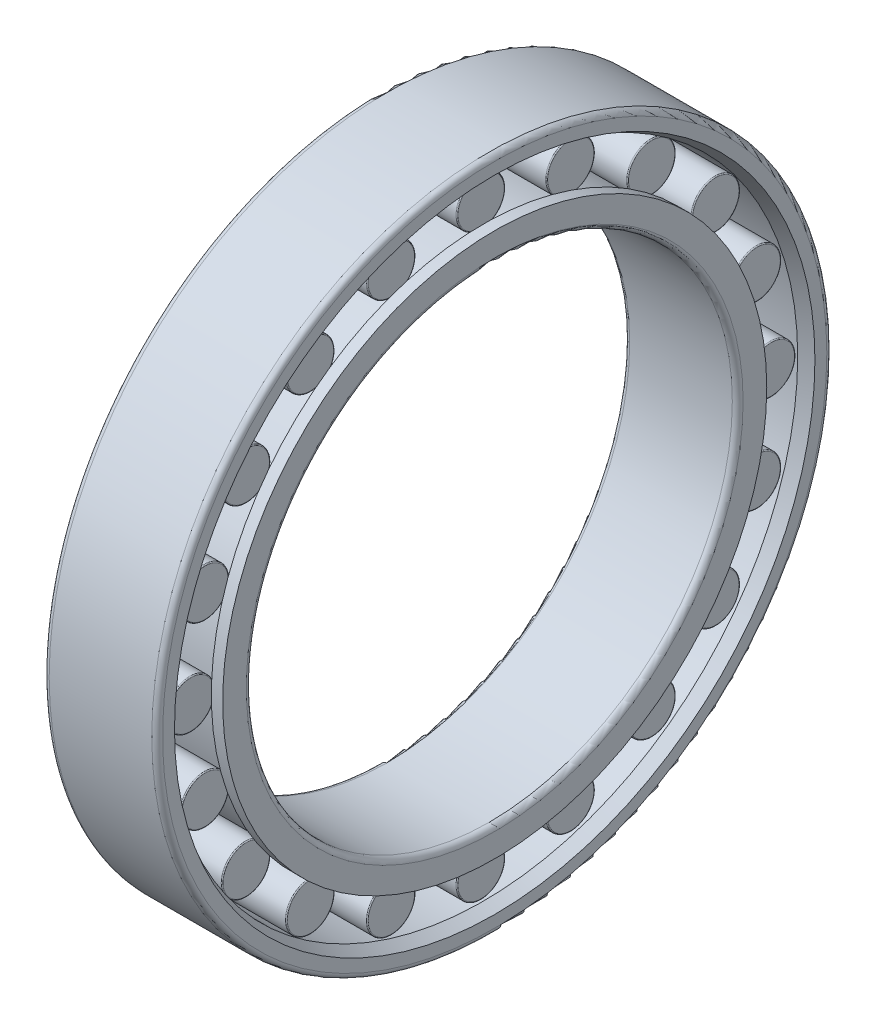
from build123d import *

# Parameters (mm, degrees)
ROLLERSDETAILED_COUNT = 20
ROLLERSDETAILED_ANGLE = 342


with BuildPart() as part:
    # OutRacSke → OuterRace (revolve)
    with BuildSketch(Plane.XY):
        with BuildLine():
            Line((16.8, 116.42), (21, 118.594375))
            Line((21, 118.594375), (21, 123))
            ThreePointArc((21, 123), (20.414213562, 124.414213562), (19, 125))
            Line((19, 125), (-19, 125))
            ThreePointArc((-19, 125), (-20.414213562, 124.414213562), (-21, 123))
            Line((-21, 123), (-21, 118.594375))
            Line((-21, 118.594375), (-16.8, 116.42))
            Line((-16.8, 116.42), (16.8, 116.42))
        make_face()
    revolve(axis=Axis((-90, 0, 0), (1, 0, 0)))

    # RolDetSke → RollerDetailed (revolve)
    with BuildSketch(Plane.XY):
        with BuildLine():
            Line((-15.96, 116.068), (-15.96, 107.5))
            Line((-15.96, 107.5), (15.96, 107.5))
            Line((15.96, 107.5), (15.96, 116.068))
            ThreePointArc((15.96, 116.068), (15.855437121, 116.320437121), (15.603, 116.425))
            Line((15.603, 116.425), (-15.603, 116.425))
            ThreePointArc((-15.603, 116.425), (-15.855437121, 116.320437121), (-15.96, 116.068))
        make_face()
    rollerdetailed = revolve(axis=Axis((-33.6, 107.5, 0), (1, 0, 0)))

    # InsRacSke → InnerRace (revolve)
    with BuildSketch(Plane.XY):
        with BuildLine():
            Line((16.8, 98.58), (16.8, 100.754375))
            Line((16.8, 100.754375), (21, 100.754375))
            Line((21, 100.754375), (21, 92))
            ThreePointArc((21, 92), (20.414213562, 90.585786438), (19, 90))
            Line((19, 90), (-19, 90))
            ThreePointArc((-19, 90), (-20.414213562, 90.585786438), (-21, 92))
            Line((-21, 92), (-21, 100.754375))
            Line((-21, 100.754375), (-16.8, 100.754375))
            Line((-16.8, 100.754375), (-16.8, 98.58))
            Line((-16.8, 98.58), (16.8, 98.58))
        make_face()
    revolve(axis=Axis((-90, 0, 0), (1, 0, 0)))

    # RollersDetailed: RollerDetailed ×20 about axis
    rollersdetailed_axis = Axis((-50, 0, 0), (1, 0, 0))
    for i in range(1, ROLLERSDETAILED_COUNT):
        add(rollerdetailed.rotate(rollersdetailed_axis, i * ROLLERSDETAILED_ANGLE / (ROLLERSDETAILED_COUNT - 1)))


solid = part.part
